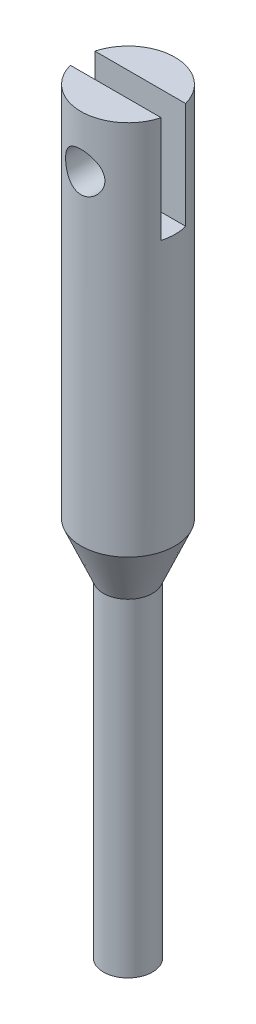
from build123d import *

# Parameters (mm, degrees)
CUT_EXTRUDE1_DEPTH      = 47.428372252
CUT_EXTRUDE1_DEPTH_BACK = 47.428372252
SKETCH2_R               = 1.2
SKETCH3_W               = 5.75
SKETCH3_H               = 1.5
CUT_EXTRUDE2_DEPTH      = 6.5


with BuildPart() as part:
    # Sketch1 → Revolve1 (revolve)
    with BuildSketch(Plane.XY):
        Polygon((0, 0), (1.5, 0), (1.5, 20.05), (2.875, 23.25), (2.875, 46.25), (0, 46.25), align=None)
    revolve(axis=Axis((0, 46.25, 0), (0, -1, 0)))

    # Sketch2 → Cut-Extrude1 (cut, two sides: drawn at the far end of the back side and taken through both)
    with BuildSketch(Plane.XY.offset(-CUT_EXTRUDE1_DEPTH_BACK)):
        with Locations((0, 43.05)):
            Circle(SKETCH2_R)
    extrude(amount=CUT_EXTRUDE1_DEPTH + CUT_EXTRUDE1_DEPTH_BACK, mode=Mode.SUBTRACT)

    # Sketch3 → Cut-Extrude2 (cut)
    with BuildSketch(Plane(origin=(0, 46.25, 0), x_dir=(1, 0, 0), z_dir=(0, 1, 0))):
        Rectangle(SKETCH3_W, SKETCH3_H)
    extrude(amount=-CUT_EXTRUDE2_DEPTH, mode=Mode.SUBTRACT)


solid = part.part
